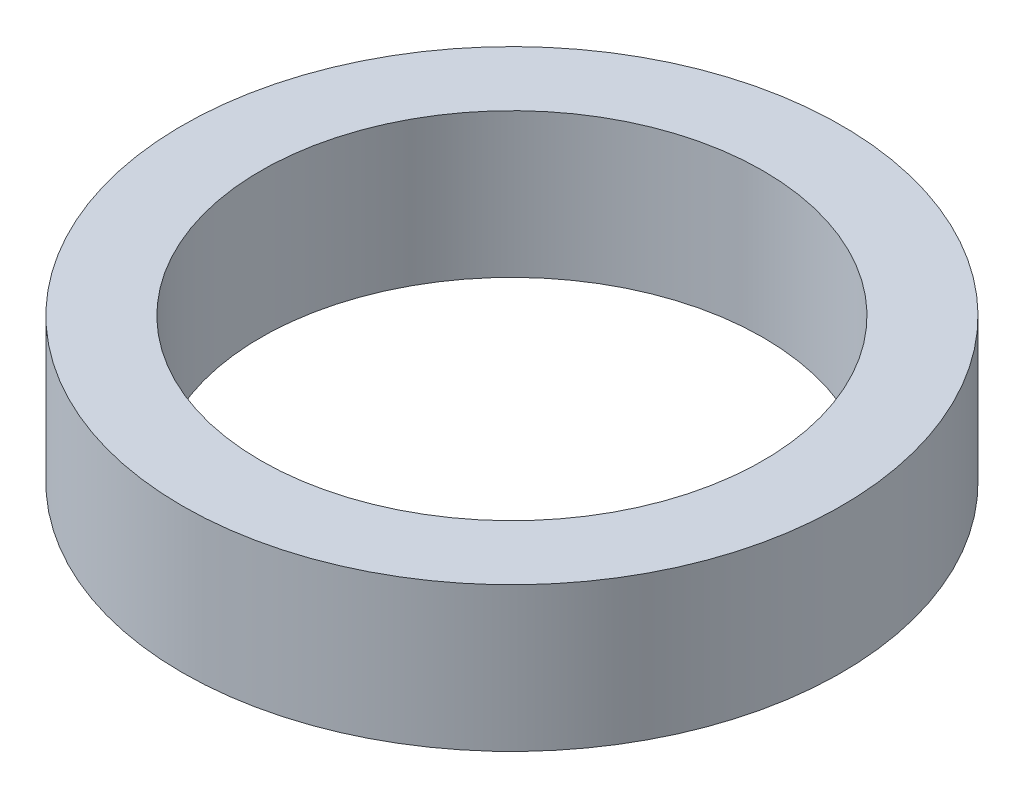
from build123d import *

# Parameters (mm, degrees)
SKETCH1_R           = 52.5
BOSS_EXTRUDE1_DEPTH = 23
SKETCH2_R           = 40
CUT_EXTRUDE1_DEPTH  = 78.727086656


with BuildPart() as part:
    # Sketch1 → Boss-Extrude1 (new body)
    with BuildSketch(Plane(origin=(0, 0, 0), x_dir=(1, 0, 0), z_dir=(0, 1, 0))):
        Circle(SKETCH1_R)
    extrude(amount=BOSS_EXTRUDE1_DEPTH)

    # Sketch2 → Cut-Extrude1 (cut, through all)
    with BuildSketch(Plane(origin=(0, 0, 0), x_dir=(1, 0, 0), z_dir=(0, 1, 0))):
        Circle(SKETCH2_R)
    extrude(amount=CUT_EXTRUDE1_DEPTH, mode=Mode.SUBTRACT)


solid = part.part
